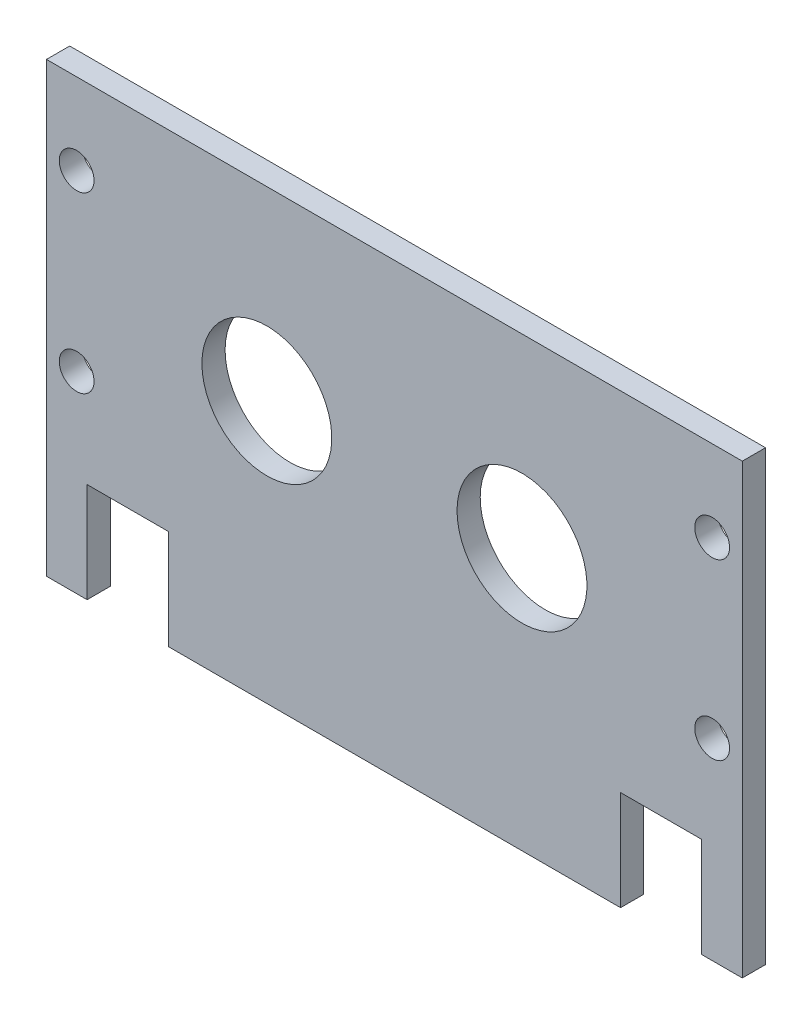
from build123d import *

# Parameters (mm, degrees)
IZIM1_W               = 300
IZIM1_H               = 150
TABAN_FLAN_1_DEPTH    = 10
IZIM6_R               = 28
KES_EKSTR_ZYON1_DEPTH = 10
IZIM7_R               = 7.5
KES_EKSTR_ZYON2_DEPTH = 15
IZIM8_W               = 17.5
IZIM8_H               = 43
IZIM8_W_2             = 195
SEKME1_DEPTH          = 10


# Sheet-metal steps are written as plain solids
with BuildPart() as part:
    # Çizim1 → Taban-Flanş1 (new body)
    with BuildSketch(Plane.XY):
        Rectangle(IZIM1_W, IZIM1_H)
    extrude(amount=-TABAN_FLAN_1_DEPTH)

    # Çizim6 → Kes-Ekstrüzyon1 (cut)
    with BuildSketch(Plane(origin=(0, 0, -10), x_dir=(-1, 0, 0), z_dir=(0, 0, -1))):
        with Locations((-55, -5)):
            Circle(IZIM6_R)
        with Locations((55, -5)):
            Circle(IZIM6_R)
    extrude(amount=-KES_EKSTR_ZYON1_DEPTH, mode=Mode.SUBTRACT)

    # Çizim7 → Kes-Ekstrüzyon2 (cut)
    with BuildSketch(Plane(origin=(0, 0, -10), x_dir=(-1, 0, 0), z_dir=(0, 0, -1))):
        with Locations((-137, 40)):
            Circle(IZIM7_R)
        with Locations((-137, -35)):
            Circle(IZIM7_R)
    kes_ekstr_zyon2 = extrude(amount=-KES_EKSTR_ZYON2_DEPTH, mode=Mode.SUBTRACT)

    # Aynalama1: Kes-Ekstrüzyon2 across plane
    add(kes_ekstr_zyon2.mirror(Plane(origin=(0, 0, 0), x_dir=(0, 0, 1), z_dir=(1, 0, 0))), mode=Mode.SUBTRACT)

    # Çizim8 → Sekme1 (add)
    with BuildSketch(Plane(origin=(0, 0, -10), x_dir=(-1, 0, 0), z_dir=(0, 0, -1))):
        with Locations((-141.25, -96.5)):
            Rectangle(IZIM8_W, IZIM8_H)
        with Locations((0, -96.5)):
            Rectangle(IZIM8_W_2, IZIM8_H)
        with Locations((141.25, -96.5)):
            Rectangle(IZIM8_W, IZIM8_H)
    extrude(amount=-SEKME1_DEPTH)


solid = part.part
